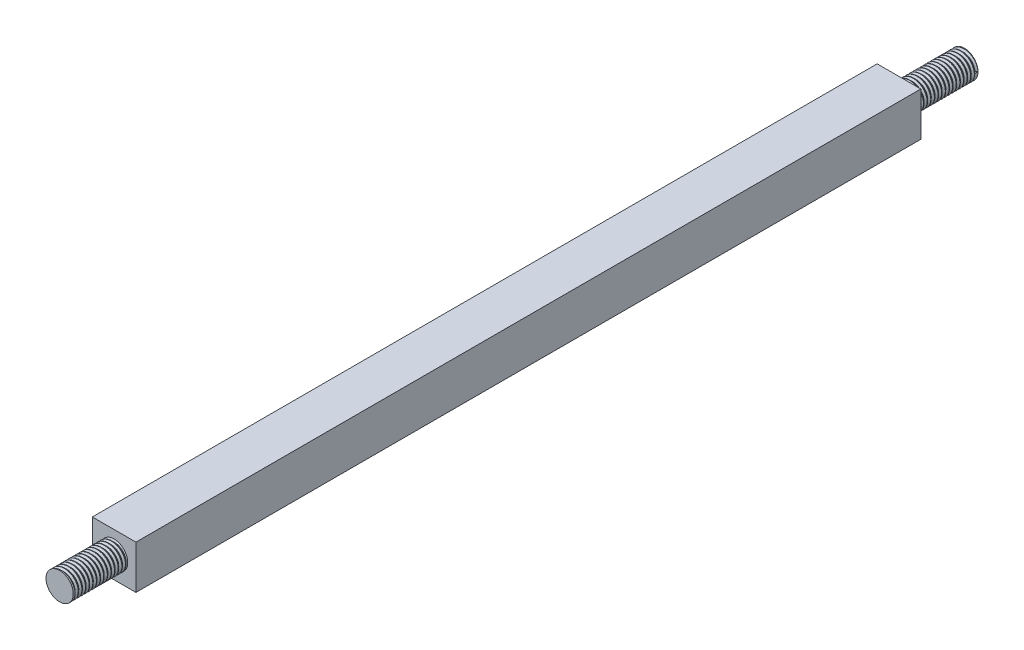
from build123d import *

# Parameters (mm, degrees)
SKETCH1_W           = 12.7
SKETCH1_H           = 12.7
BOSS_EXTRUDE1_DEPTH = 228.6
SKETCH2_R           = 3.96875
BOSS_EXTRUDE2_DEPTH = 15.875
THREAD1_PITCH       = 1.058333333
BOSS_EXTRUDE3_START = 19.05
SKETCH6_R           = 3.96875
BOSS_EXTRUDE3_DEPTH = 19.05
THREAD2_PITCH       = 1.058333333


with BuildPart() as part:
    # Sketch1 → Boss-Extrude1 (new body)
    with BuildSketch(Plane.XY):
        Rectangle(SKETCH1_W, SKETCH1_H)
    extrude(amount=BOSS_EXTRUDE1_DEPTH)

    # Sketch2 → Boss-Extrude2 (add)
    with BuildSketch(Plane.XY.offset(228.6)):
        Circle(SKETCH2_R)
    extrude(amount=BOSS_EXTRUDE2_DEPTH)

    # Thread1: the profile of Thread Profile1 profile screwed along a right-hand helix of 15 turns, 8 arcs to a turn; built about Z, then put on its axis
    thread1_z = Axis((0, 0, 0), (0, 0, 1))
    thread1_corners = [(3.96905, 0, -0.000173205), (3.96905, 0, 0.926214869), (3.395910282, 0, 0.595312499), (3.395910282, 0, 0.330729165)]
    with BuildLine(mode=Mode.PRIVATE) as thread1_profile:
        Line(thread1_corners[0], thread1_corners[1])
        Line(thread1_corners[1], thread1_corners[2])
        Line(thread1_corners[2], thread1_corners[3])
        Line(thread1_corners[3], thread1_corners[0])
    thread1_cap = Face(thread1_profile.wire())
    thread1_turn_angles = [0, 22.5, 45, 67.5, 90, 112.5, 135, 157.5, 180, 202.5, 225, 247.5, 270, 292.5, 315, 337.5, 360]
    thread1_turn_weights = [1, 0.9238795325112867, 1, 0.9238795325112867, 1, 0.9238795325112867, 1, 0.9238795325112867, 1, 0.9238795325112867, 1, 0.9238795325112867, 1, 0.9238795325112867, 1, 0.9238795325112867, 1]
    thread1_turn_rails = [Edge.make_bspline([Vector(p[0], p[1], 0).rotate(thread1_z, thread1_turn_angles[k]) / thread1_turn_weights[k] + Vector(0, 0, p[2] + THREAD1_PITCH * thread1_turn_angles[k] / 360) for k in range(17)], [0, 0, 0, 1, 1, 2, 2, 3, 3, 4, 4, 5, 5, 6, 6, 7, 7, 8, 8, 8], 2, thread1_turn_weights) for p in thread1_corners]
    thread1_turn_sides = [Face.make_surface_from_curves(thread1_turn_rails[p[0]], thread1_turn_rails[p[1]]) for p in [(0, 1), (1, 2), (2, 3), (3, 0)]]
    thread1 = Plane(origin=(0, 0, 244.475), x_dir=(-1, 0, 0), z_dir=(0, 0, -1)) * Solid(Shell([*[p.moved(Location((0, 0, THREAD1_PITCH * i))) for i in range(15) for p in thread1_turn_sides], thread1_cap, thread1_cap.rotate(thread1_z, 5400).moved(Location((0, 0, THREAD1_PITCH * 5400 / 360)))]))
    add(thread1, mode=Mode.SUBTRACT)

    # Sketch6 → Boss-Extrude3 (add)
    with BuildSketch(Plane(origin=(0, 0, 0), x_dir=(-1, 0, 0), z_dir=(0, 0, -1)).offset(BOSS_EXTRUDE3_START)):
        with Locations(Location((0, 0, 0), (0, 0, 180))):
            Circle(SKETCH6_R)
    extrude(amount=-BOSS_EXTRUDE3_DEPTH)

    # Thread2: the profile of Thread Profile2 profile screwed along a right-hand helix of 18 turns, 8 arcs to a turn; built about Z, then put on its axis
    thread2_z = Axis((0, 0, 0), (0, 0, 1))
    thread2_corners = [(3.96905, 0, -0.000173205), (3.96905, 0, 0.926214869), (3.395910282, 0, 0.595312499), (3.395910282, 0, 0.330729165)]
    with BuildLine(mode=Mode.PRIVATE) as thread2_profile:
        Line(thread2_corners[0], thread2_corners[1])
        Line(thread2_corners[1], thread2_corners[2])
        Line(thread2_corners[2], thread2_corners[3])
        Line(thread2_corners[3], thread2_corners[0])
    thread2_cap = Face(thread2_profile.wire())
    thread2_turn_angles = [0, 22.5, 45, 67.5, 90, 112.5, 135, 157.5, 180, 202.5, 225, 247.5, 270, 292.5, 315, 337.5, 360]
    thread2_turn_weights = [1, 0.9238795325112867, 1, 0.9238795325112867, 1, 0.9238795325112867, 1, 0.9238795325112867, 1, 0.9238795325112867, 1, 0.9238795325112867, 1, 0.9238795325112867, 1, 0.9238795325112867, 1]
    thread2_turn_rails = [Edge.make_bspline([Vector(p[0], p[1], 0).rotate(thread2_z, thread2_turn_angles[k]) / thread2_turn_weights[k] + Vector(0, 0, p[2] + THREAD2_PITCH * thread2_turn_angles[k] / 360) for k in range(17)], [0, 0, 0, 1, 1, 2, 2, 3, 3, 4, 4, 5, 5, 6, 6, 7, 7, 8, 8, 8], 2, thread2_turn_weights) for p in thread2_corners]
    thread2_turn_sides = [Face.make_surface_from_curves(thread2_turn_rails[p[0]], thread2_turn_rails[p[1]]) for p in [(0, 1), (1, 2), (2, 3), (3, 0)]]
    thread2 = Plane(origin=(0, 0, -19.05), x_dir=(1, 0, 0), z_dir=(0, 0, 1)) * Solid(Shell([*[p.moved(Location((0, 0, THREAD2_PITCH * i))) for i in range(18) for p in thread2_turn_sides], thread2_cap, thread2_cap.rotate(thread2_z, 6480).moved(Location((0, 0, THREAD2_PITCH * 6480 / 360)))]))
    add(thread2, mode=Mode.SUBTRACT)


solid = part.part
